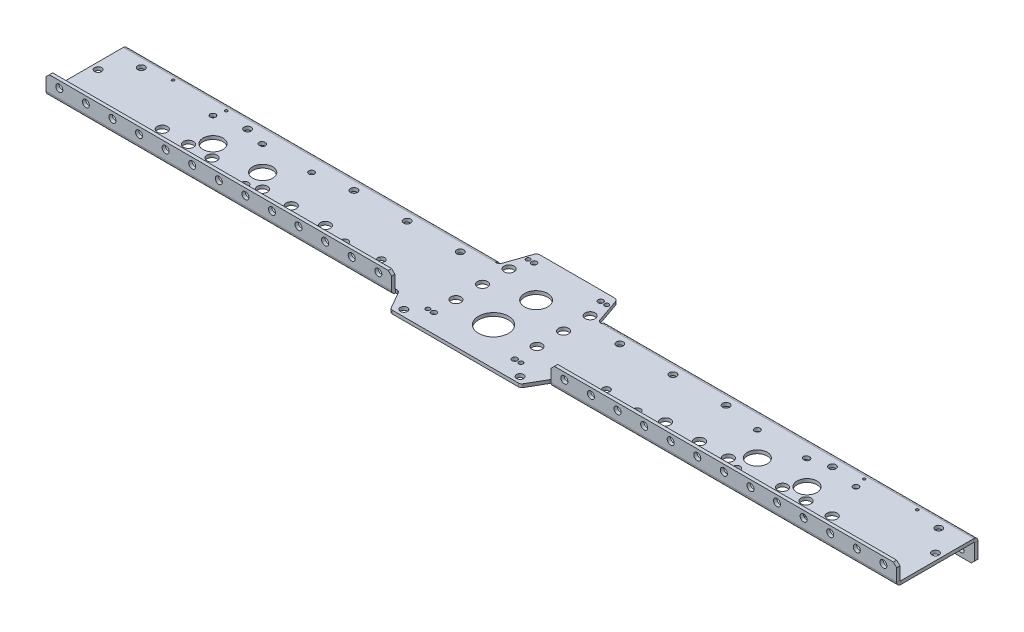
from build123d import *

# Parameters (mm, degrees)
SKETCH1_W                      = 812.8
SKETCH1_H                      = 69.85
BOSS_EXTRUDE1_DEPTH            = 3.175
SKETCH3_R                      = 14.2875
CUT_EXTRUDE1_DEPTH             = 816.802024467
EDGE_FLANGE1_DEPTH             = 812.8
EDGE_FLANGE2_DEPTH             = 812.8
SKETCH10_R                     = 4.826
LONG_6WD_DEPTH                 = 817.444922817
SKETCH11_R                     = 4.826
SHORT_6WD_DEPTH                = 817.444922817
SKETCH12_R                     = 3.3528
F_8WD_EGG_DEPTH                = 817.444922817
SKETCH13_R                     = 3.3528
LOWER_CHURRO_DEPTH             = 817.444922817
SKETCH14_R                     = 2.667
UPPER_FLANGE_HP_DEPTH          = 817.729920277
SKETCH16_R                     = 3.3528
LOWER_FLANGE_HP_DEPTH          = 817.433889486
LPATTERN1_COUNT                = 32
LPATTERN1_PITCH                = 25.4
SKETCH17_W                     = 152.4
SKETCH17_H                     = 6.35
CUT_EXTRUDE9_DEPTH             = 818.031193633
SKETCH18_W                     = 146.05
SKETCH18_H                     = 3.175
BOSS_EXTRUDE2_DEPTH            = 19.05
SKETCH19_W                     = 101.6
SKETCH19_H                     = 3.937
CUT_EXTRUDE10_DEPTH            = 818.031193633
SKETCH20_W                     = 95.25
SKETCH20_H                     = 3.175
BOSS_EXTRUDE3_DEPTH            = 27.432
CUT_EXTRUDE14_DEPTH            = 819.902667079
SKETCH21_R                     = 11.1125
SKETCH21_R_2                   = 4.7625
SKETCH21_R_3                   = 2.54
SKETCH21_R_4                   = 2.032
TB_MINI_SHAFT_PLATE_DEPTH      = 819.8226487
CUT_EXTRUDE12_DEPTH            = 819.8226487
SKETCH23_R                     = 3.3528
UPPER_INTERNAL_CHIRRO_HP_DEPTH = 819.8226487
SKETCH24_R                     = 1.27
CUTTING_GUIDES_DEPTH           = 819.8226487
SKETCH26_R                     = 3.4036
SONIC_MOUNTING_HOLES_DEPTH     = 819.902667079
SKETCH25_R                     = 9.525
SKETCH25_R_2                   = 2.667
MECANUM_LONG_DEPTH             = 3.175
FILLET1_R                      = 3.175
CHAMFER1_SIZE                  = 3.175
SKETCH29_R                     = 9.525
SKETCH29_R_2                   = 2.667
CUT_EXTRUDE15_DEPTH            = 819.902667079


# Sheet-metal steps are written as plain solids
with BuildPart() as part:
    # Sketch1 → Boss-Extrude1 (new body)
    with BuildSketch(Plane(origin=(0, 0, 0), x_dir=(1, 0, 0), z_dir=(0, 1, 0))):
        with Locations((406.4, 34.925)):
            Rectangle(SKETCH1_W, SKETCH1_H)
    extrude(amount=BOSS_EXTRUDE1_DEPTH)

    # Sketch3 → Cut-Extrude1 (cut, through all)
    with BuildSketch(Plane(origin=(0, 3.175, 0), x_dir=(1, 0, 0), z_dir=(0, 1, 0))):
        with Locations(Location((406.4, 17.272, 0), (0, 0, 270))):
            Circle(SKETCH3_R)
    extrude(amount=-CUT_EXTRUDE1_DEPTH, mode=Mode.SUBTRACT)

    # Edge-Flange1 section (across the edge) → Edge-Flange1 (add)
    with BuildSketch(Plane(origin=(0, 3.175, 0.762), x_dir=(0, 0, -1), z_dir=(1, 0, 0))):
        with BuildLine():
            Line((-3.175, 0.762), (-3.175, 15.875))
            Line((-3.175, 15.875), (0, 15.875))
            Line((0, 15.875), (0, 0.762))
            ThreePointArc((0, 0.762), (0.223184633, 0.223184633), (0.762, 0))
            Line((0.762, 0), (0.762, -3.175))
            ThreePointArc((0.762, -3.175), (-2.021879398, -2.021879398), (-3.175, 0.762))
        make_face()
    extrude(amount=EDGE_FLANGE1_DEPTH)

    # Edge-Flange2 section (across the edge) → Edge-Flange2 (add)
    with BuildSketch(Plane(origin=(0, 0, -70.612), x_dir=(0, 0, 1), z_dir=(1, 0, 0))):
        with BuildLine():
            Line((-3.175, 0.762), (-3.175, 19.05))
            Line((-3.175, 19.05), (0, 19.05))
            Line((0, 19.05), (0, 0.762))
            ThreePointArc((0, 0.762), (0.223184633, 0.223184633), (0.762, 0))
            Line((0.762, 0), (0.762, -3.175))
            ThreePointArc((0.762, -3.175), (-2.021879398, -2.021879398), (-3.175, 0.762))
        make_face()
    extrude(amount=EDGE_FLANGE2_DEPTH)

    # Sketch10 → Long 6wd (cut, through all)
    with BuildSketch(Plane(origin=(0, 3.175, 0), x_dir=(1, 0, 0), z_dir=(0, 1, 0))):
        with Locations(Location((86.339113657, 20.828, 0), (0, 0, 270))):
            Circle(SKETCH10_R)
        with Locations(Location((111.349627997, 20.828, 0), (0, 0, 270))):
            Circle(SKETCH10_R)
        with Locations(Location((133.855797334, 20.828, 0), (0, 0, 270))):
            Circle(SKETCH10_R)
        with Locations(Location((726.460886343, 20.828, 0), (0, 0, 270))):
            Circle(SKETCH10_R)
        with Locations(Location((701.450372003, 20.828, 0), (0, 0, 270))):
            Circle(SKETCH10_R)
        with Locations(Location((678.944202666, 20.828, 0), (0, 0, 270))):
            Circle(SKETCH10_R)
    extrude(amount=-LONG_6WD_DEPTH, mode=Mode.SUBTRACT)

    # Sketch11 → Short 6wd (cut, through all)
    with BuildSketch(Plane(origin=(0, 3.175, 0), x_dir=(1, 0, 0), z_dir=(0, 1, 0))):
        with Locations(Location((183.852302373, 19.05, 0), (0, 0, 270))):
            Circle(SKETCH11_R)
        with Locations(Location((211.361504088, 19.05, 0), (0, 0, 270))):
            Circle(SKETCH11_R)
        with Locations(Location((243.875125248, 19.05, 0), (0, 0, 270))):
            Circle(SKETCH11_R)
        with Locations(Location((568.924874752, 19.05, 0), (0, 0, 270))):
            Circle(SKETCH11_R)
        with Locations(Location((601.438495912, 19.05, 0), (0, 0, 270))):
            Circle(SKETCH11_R)
        with Locations(Location((628.947697627, 19.05, 0), (0, 0, 270))):
            Circle(SKETCH11_R)
    extrude(amount=-SHORT_6WD_DEPTH, mode=Mode.SUBTRACT)

    # Sketch12 → 8wd egg (cut, through all)
    with BuildSketch(Plane(origin=(0, 3.175, 0), x_dir=(1, 0, 0), z_dir=(0, 1, 0))):
        with Locations(Location((298.874532383, 17.547282407, 0), (0, 0, 270))):
            Circle(SKETCH12_R)
        with Locations(Location((513.925467617, 17.547282407, 0), (0, 0, 270))):
            Circle(SKETCH12_R)
    extrude(amount=-F_8WD_EGG_DEPTH, mode=Mode.SUBTRACT)

    # Sketch13 → lower churro (cut, through all)
    with BuildSketch(Plane(origin=(0, 3.175, 0), x_dir=(1, 0, 0), z_dir=(0, 1, 0))):
        with Locations(Location((171.45, 14.732, 0), (0, 0, 270))):
            Circle(SKETCH13_R)
        with Locations(Location((266.7, 14.732, 0), (0, 0, 270))):
            Circle(SKETCH13_R)
        with Locations(Location((546.1, 14.732, 0), (0, 0, 270))):
            Circle(SKETCH13_R)
        with Locations(Location((641.35, 14.732, 0), (0, 0, 270))):
            Circle(SKETCH13_R)
    extrude(amount=-LOWER_CHURRO_DEPTH, mode=Mode.SUBTRACT)

    # Sketch14 → upper flange HP (cut, through all)
    with BuildSketch(Plane(origin=(0, 0, -73.787), x_dir=(-1, 0, 0), z_dir=(0, 0, -1))):
        with Locations(Location((-12.7, -12.7, 0), (0, 0, 90))):
            Circle(SKETCH14_R)
        with Locations(Location((-38.1, -12.7, 0), (0, 0, 90))):
            Circle(SKETCH14_R)
        with Locations(Location((-63.5, -12.7, 0), (0, 0, 90))):
            Circle(SKETCH14_R)
        with Locations(Location((-88.9, -12.7, 0), (0, 0, 90))):
            Circle(SKETCH14_R)
        with Locations(Location((-114.3, -12.7, 0), (0, 0, 90))):
            Circle(SKETCH14_R)
        with Locations(Location((-139.7, -12.7, 0), (0, 0, 90))):
            Circle(SKETCH14_R)
        with Locations(Location((-165.1, -12.7, 0), (0, 0, 90))):
            Circle(SKETCH14_R)
        with Locations(Location((-190.5, -12.7, 0), (0, 0, 90))):
            Circle(SKETCH14_R)
        with Locations(Location((-215.9, -12.7, 0), (0, 0, 90))):
            Circle(SKETCH14_R)
        with Locations(Location((-241.3, -12.7, 0), (0, 0, 90))):
            Circle(SKETCH14_R)
        with Locations(Location((-266.7, -12.7, 0), (0, 0, 90))):
            Circle(SKETCH14_R)
        with Locations(Location((-292.1, -12.7, 0), (0, 0, 90))):
            Circle(SKETCH14_R)
        with Locations(Location((-317.5, -12.7, 0), (0, 0, 90))):
            Circle(SKETCH14_R)
        with Locations(Location((-342.9, -12.7, 0), (0, 0, 90))):
            Circle(SKETCH14_R)
        with Locations(Location((-368.3, -12.7, 0), (0, 0, 90))):
            Circle(SKETCH14_R)
        with Locations(Location((-393.7, -12.7, 0), (0, 0, 90))):
            Circle(SKETCH14_R)
        with Locations(Location((-419.1, -12.7, 0), (0, 0, 90))):
            Circle(SKETCH14_R)
        with Locations(Location((-444.5, -12.7, 0), (0, 0, 90))):
            Circle(SKETCH14_R)
        with Locations(Location((-469.9, -12.7, 0), (0, 0, 90))):
            Circle(SKETCH14_R)
        with Locations(Location((-495.3, -12.7, 0), (0, 0, 90))):
            Circle(SKETCH14_R)
        with Locations(Location((-520.7, -12.7, 0), (0, 0, 90))):
            Circle(SKETCH14_R)
        with Locations(Location((-546.1, -12.7, 0), (0, 0, 90))):
            Circle(SKETCH14_R)
        with Locations(Location((-571.5, -12.7, 0), (0, 0, 90))):
            Circle(SKETCH14_R)
        with Locations(Location((-596.9, -12.7, 0), (0, 0, 90))):
            Circle(SKETCH14_R)
        with Locations(Location((-622.3, -12.7, 0), (0, 0, 90))):
            Circle(SKETCH14_R)
        with Locations(Location((-647.7, -12.7, 0), (0, 0, 90))):
            Circle(SKETCH14_R)
        with Locations(Location((-673.1, -12.7, 0), (0, 0, 90))):
            Circle(SKETCH14_R)
        with Locations(Location((-698.5, -12.7, 0), (0, 0, 90))):
            Circle(SKETCH14_R)
        with Locations(Location((-723.9, -12.7, 0), (0, 0, 90))):
            Circle(SKETCH14_R)
        with Locations(Location((-749.3, -12.7, 0), (0, 0, 90))):
            Circle(SKETCH14_R)
        with Locations(Location((-774.7, -12.7, 0), (0, 0, 90))):
            Circle(SKETCH14_R)
        with Locations(Location((-800.1, -12.7, 0), (0, 0, 90))):
            Circle(SKETCH14_R)
    extrude(amount=-UPPER_FLANGE_HP_DEPTH, mode=Mode.SUBTRACT)

    # Sketch16 → Lower flange HP (cut, through all)
    with BuildSketch(Plane(origin=(0, 0, 0.762), x_dir=(-1, 0, 0), z_dir=(0, 0, -1))):
        with Locations(Location((-12.7, 12.7, 0), (0, 0, 90))):
            Circle(SKETCH16_R)
    lower_flange_hp = extrude(amount=-LOWER_FLANGE_HP_DEPTH, mode=Mode.SUBTRACT)

    # LPattern1: Lower flange HP ×32
    with Locations(*[(i * LPATTERN1_PITCH, 0, 0) for i in range(1, LPATTERN1_COUNT)]):
        add(lower_flange_hp, mode=Mode.SUBTRACT)

    # Sketch17 → Cut-Extrude9 (cut, through all)
    with BuildSketch(Plane(origin=(0, 19.05, 0), x_dir=(1, 0, 0), z_dir=(0, 1, 0))):
        with Locations((406.4, -3.175)):
            Rectangle(SKETCH17_W, SKETCH17_H)
    extrude(amount=-CUT_EXTRUDE9_DEPTH, mode=Mode.SUBTRACT)

    # Sketch18 → Boss-Extrude2 (add)
    with BuildSketch(Plane.XY):
        with Locations((406.4, 1.5875)):
            Rectangle(SKETCH18_W, SKETCH18_H)
    extrude(amount=BOSS_EXTRUDE2_DEPTH)

    # Sketch19 → Cut-Extrude10 (cut, through all)
    with BuildSketch(Plane.XZ.offset(19.05)):
        with Locations((406.4, -71.8185)):
            Rectangle(SKETCH19_W, SKETCH19_H)
    extrude(amount=-CUT_EXTRUDE10_DEPTH, mode=Mode.SUBTRACT)

    # Sketch20 → Boss-Extrude3 (add)
    with BuildSketch(Plane(origin=(0, 0, -69.85), x_dir=(-1, 0, 0), z_dir=(0, 0, -1))):
        with Locations((-406.4, 1.5875)):
            Rectangle(SKETCH20_W, SKETCH20_H)
    extrude(amount=BOSS_EXTRUDE3_DEPTH)

    # Sketch27 → Cut-Extrude14 (cut, through all)
    with BuildSketch(Plane(origin=(0, 3.175, 0), x_dir=(1, 0, 0), z_dir=(0, 1, 0))):
        Polygon((333.375, 0), (344.373522628, -19.05), (333.375, -19.05), align=None)
        Polygon((479.425, 0), (479.425, -19.05), (468.426477372, -19.05), align=None)
    extrude(amount=-CUT_EXTRUDE14_DEPTH, mode=Mode.SUBTRACT)

    # Sketch21 → TB Mini Shaft plate (cut, through all)
    with BuildSketch(Plane.XZ):
        with Locations(Location((406.4, -57.9628, 0), (0, 0, 270))):
            Circle(SKETCH21_R)
        with Locations(Location((445.12429721, -45.466, 0), (0, 0, 270))):
            Circle(SKETCH21_R_2)
        with Locations(Location((367.67570279, -45.466, 0), (0, 0, 270))):
            Circle(SKETCH21_R_2)
        with Locations(Location((445.12429721, -70.866, 0), (0, 0, 270))):
            Circle(SKETCH21_R_2)
        with Locations(Location((445.12429721, -20.066, 0), (0, 0, 270))):
            Circle(SKETCH21_R_2)
        with Locations(Location((367.67570279, -20.066, 0), (0, 0, 270))):
            Circle(SKETCH21_R_2)
        with Locations(Location((367.67570279, -70.866, 0), (0, 0, 270))):
            Circle(SKETCH21_R_2)
        with Locations(Location((438.15, -87.85352, 0), (0, 0, 270))):
            Circle(SKETCH21_R_3)
        with Locations(Location((374.65, -87.85352, 0), (0, 0, 270))):
            Circle(SKETCH21_R_3)
        with Locations(Location((443.992, -87.85352, 0), (0, 0, 270))):
            Circle(SKETCH21_R_4)
        with Locations(Location((368.808, -87.85352, 0), (0, 0, 270))):
            Circle(SKETCH21_R_4)
        with Locations(Location((445.0461, 1.03886, 0), (0, 0, 270))):
            Circle(SKETCH21_R_3)
        with Locations(Location((367.7539, 1.03886, 0), (0, 0, 270))):
            Circle(SKETCH21_R_3)
        with Locations(Location((361.9119, 1.03886, 0), (0, 0, 270))):
            Circle(SKETCH21_R_4)
        with Locations(Location((450.8881, 1.03886, 0), (0, 0, 270))):
            Circle(SKETCH21_R_4)
    extrude(amount=-TB_MINI_SHAFT_PLATE_DEPTH, mode=Mode.SUBTRACT)

    # Sketch22 → Cut-Extrude12 (cut, through all)
    with BuildSketch(Plane.XZ):
        Polygon((454.025, -69.85), (444.579404912, -97.282), (454.025, -97.282), align=None)
        Polygon((358.775, -69.85), (368.220595088, -97.282), (358.775, -97.282), align=None)
    extrude(amount=-CUT_EXTRUDE12_DEPTH, mode=Mode.SUBTRACT)

    # Sketch23 → Upper internal chirro HP (cut, through all)
    with BuildSketch(Plane.XZ):
        with Locations(Location((330.2, -61.722, 0), (0, 0, 270))):
            Circle(SKETCH23_R)
        with Locations(Location((279.4, -61.722, 0), (0, 0, 270))):
            Circle(SKETCH23_R)
        with Locations(Location((228.6, -61.722, 0), (0, 0, 270))):
            Circle(SKETCH23_R)
        with Locations(Location((127, -61.722, 0), (0, 0, 270))):
            Circle(SKETCH23_R)
        with Locations(Location((25.4, -61.722, 0), (0, 0, 270))):
            Circle(SKETCH23_R)
        with Locations(Location((482.6, -61.722, 0), (0, 0, 270))):
            Circle(SKETCH23_R)
        with Locations(Location((533.4, -61.722, 0), (0, 0, 270))):
            Circle(SKETCH23_R)
        with Locations(Location((584.2, -61.722, 0), (0, 0, 270))):
            Circle(SKETCH23_R)
        with Locations(Location((685.8, -61.722, 0), (0, 0, 270))):
            Circle(SKETCH23_R)
        with Locations(Location((787.4, -61.722, 0), (0, 0, 270))):
            Circle(SKETCH23_R)
        with Locations(Location((6.35, -39.497, 0), (0, 0, 270))):
            Circle(SKETCH23_R)
        with Locations(Location((806.45, -39.497, 0), (0, 0, 270))):
            Circle(SKETCH23_R)
    extrude(amount=-UPPER_INTERNAL_CHIRRO_HP_DEPTH, mode=Mode.SUBTRACT)

    # Sketch24 → Cutting guides (cut, through all)
    with BuildSketch(Plane.XZ):
        with Locations(Location((101.6, -3.175, 0), (0, 0, 270))):
            Circle(SKETCH24_R)
        with Locations(Location((101.6, -66.675, 0), (0, 0, 270))):
            Circle(SKETCH24_R)
        with Locations(Location((50.8, -66.675, 0), (0, 0, 270))):
            Circle(SKETCH24_R)
        with Locations(Location((50.8, -3.175, 0), (0, 0, 270))):
            Circle(SKETCH24_R)
        with Locations(Location((762, -66.675, 0), (0, 0, 270))):
            Circle(SKETCH24_R)
        with Locations(Location((762, -3.175, 0), (0, 0, 270))):
            Circle(SKETCH24_R)
        with Locations(Location((711.2, -3.175, 0), (0, 0, 270))):
            Circle(SKETCH24_R)
        with Locations(Location((711.2, -66.675, 0), (0, 0, 270))):
            Circle(SKETCH24_R)
    extrude(amount=-CUTTING_GUIDES_DEPTH, mode=Mode.SUBTRACT)

    # Sketch26 → Sonic mounting holes (cut, through all)
    with BuildSketch(Plane(origin=(0, 3.175, 0), x_dir=(1, 0, 0), z_dir=(0, 1, 0))):
        with Locations(Location((350.8375, -12.8905, 0), (0, 0, 270))):
            Circle(SKETCH26_R)
        with Locations(Location((461.9625, -12.8905, 0), (0, 0, 270))):
            Circle(SKETCH26_R)
    extrude(amount=-SONIC_MOUNTING_HOLES_DEPTH, mode=Mode.SUBTRACT)

    # Sketch25 → mecanum long (cut)
    with BuildSketch(Plane(origin=(0, 3.175, 0), x_dir=(1, 0, 0), z_dir=(0, 1, 0))):
        with Locations(Location((690.197287335, 33.02, 0), (0, 0, 270))):
            Circle(SKETCH25_R)
        with Locations(Location((713.545953249, 9.671334085, 0), (0, 0, 90))):
            Circle(SKETCH25_R_2)
        with Locations(Location((713.545953249, 56.368665915, 0), (0, 0, 90))):
            Circle(SKETCH25_R_2)
        with Locations(Location((666.84862142, 56.368665915, 0), (0, 0, 270))):
            Circle(SKETCH25_R_2)
        with Locations(Location((666.84862142, 9.671334085, 0), (0, 0, 270))):
            Circle(SKETCH25_R_2)
        with Locations(Location((99.254046751, 56.368665915, 0), (0, 0, 270))):
            Circle(SKETCH25_R_2)
        with Locations(Location((99.254046751, 9.671334085, 0), (0, 0, 270))):
            Circle(SKETCH25_R_2)
        with Locations(Location((145.95137858, 9.671334085, 0), (0, 0, 90))):
            Circle(SKETCH25_R_2)
        with Locations(Location((145.95137858, 56.368665915, 0), (0, 0, 90))):
            Circle(SKETCH25_R_2)
        with Locations(Location((122.602712665, 33.02, 0), (0, 0, 90))):
            Circle(SKETCH25_R)
    extrude(amount=-MECANUM_LONG_DEPTH, mode=Mode.SUBTRACT)

    # Fillet1
    fillet1_edges = [part.edges().sort_by_distance(p)[0] for p in [
        (333.375, 1.5875, 0),
        (479.425, 1.5875, 0),
        (454.025, 1.5875, -69.85),
        (358.775, 1.5875, -69.85),
        (468.426477372, 1.5875, 19.05),
        (344.373522628, 1.5875, 19.05),
        (368.220595088, 1.5875, -97.282),
        (444.579404912, 1.5875, -97.282),
    ]]
    fillet(fillet1_edges, radius=FILLET1_R)

    # Chamfer1
    chamfer1_edges = [part.edges().sort_by_distance(p)[0] for p in [
        (0, 19.05, 2.3495),
        (812.8, 19.05, 2.3495),
        (482.6, 19.05, 2.3495),
        (330.2, 19.05, 2.3495),
        (0, -19.05, -72.1995),
        (812.8, -19.05, -72.1995),
        (355.6, -19.05, -72.1995),
        (457.2, -19.05, -72.1995),
    ]]
    chamfer(chamfer1_edges, length=CHAMFER1_SIZE)

    # Sketch29 → Cut-Extrude15 (cut, through all)
    with BuildSketch(Plane(origin=(0, 3.175, 0), x_dir=(1, 0, 0), z_dir=(0, 1, 0))):
        with Locations(Location((642.712889143, 33.02, 0), (0, 0, 90))):
            Circle(SKETCH29_R)
        with Locations(Location((619.364223229, 56.368665915, 0), (0, 0, 90))):
            Circle(SKETCH29_R_2)
        with Locations((666.061555058, 56.368665915)):
            Circle(SKETCH29_R_2)
        with Locations((666.061555058, 9.671334085)):
            Circle(SKETCH29_R_2)
        with Locations(Location((619.364223229, 9.671334085, 0), (0, 0, 90))):
            Circle(SKETCH29_R_2)
        with Locations(Location((193.435776771, 56.368665915, 0), (0, 0, 90))):
            Circle(SKETCH29_R_2)
        with Locations((146.738444942, 56.368665915)):
            Circle(SKETCH29_R_2)
        with Locations(Location((170.087110857, 33.02, 0), (0, 0, 90))):
            Circle(SKETCH29_R)
        with Locations((146.738444942, 9.671334085)):
            Circle(SKETCH29_R_2)
        with Locations(Location((193.435776771, 9.671334085, 0), (0, 0, 90))):
            Circle(SKETCH29_R_2)
    extrude(amount=-CUT_EXTRUDE15_DEPTH, mode=Mode.SUBTRACT)


solid = part.part
